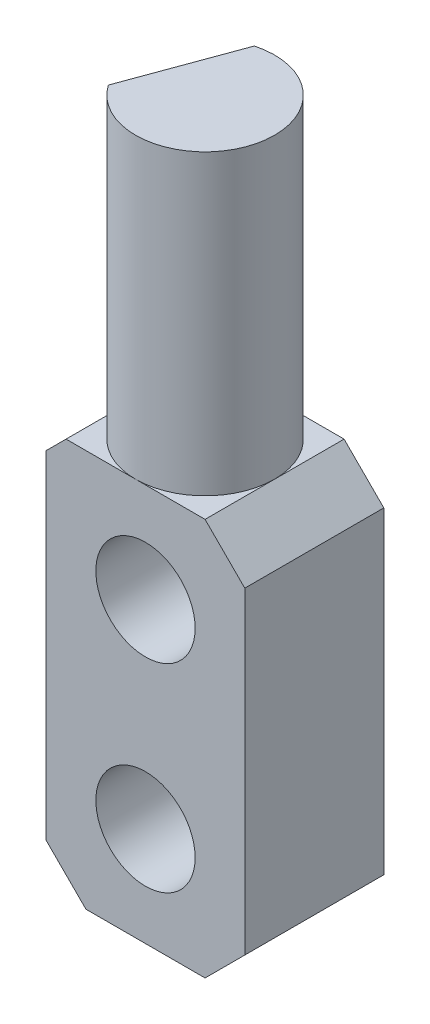
from build123d import *

# Parameters (mm, degrees)
SKETCH1_W               = 10
SKETCH1_H               = 20
BOSS_EXTRUDE1_DEPTH     = 7
SKETCH2_R               = 3.5
BOSS_EXTRUDE2_DEPTH     = 15
SKETCH3_R               = 2.5
CUT_EXTRUDE1_DEPTH      = 38.067505986
CUT_EXTRUDE2_DEPTH      = 37.961317978
CUT_EXTRUDE2_DEPTH_BACK = 37.961317978
CHAMFER1_SIZE           = 2
CHAMFER2_SIZE           = 1


with BuildPart() as part:
    # Sketch1 → Boss-Extrude1 (new body)
    with BuildSketch(Plane.XY):
        with Locations((5, 10)):
            Rectangle(SKETCH1_W, SKETCH1_H)
    extrude(amount=BOSS_EXTRUDE1_DEPTH)

    # Sketch2 → Boss-Extrude2 (add)
    with BuildSketch(Plane(origin=(0, 20, 0), x_dir=(1, 0, 0), z_dir=(0, 1, 0))):
        with Locations(Location((4.5, -3.5, 0), (0, 0, 90))):
            Circle(SKETCH2_R)
    extrude(amount=BOSS_EXTRUDE2_DEPTH)

    # Sketch3 → Cut-Extrude1 (cut, through all)
    with BuildSketch(Plane.XY.offset(7)):
        with Locations((5, 15)):
            Circle(SKETCH3_R)
        with Locations((5, 5)):
            Circle(SKETCH3_R)
    extrude(amount=-CUT_EXTRUDE1_DEPTH, mode=Mode.SUBTRACT)

    # Sketch4 → Cut-Extrude2 (cut, two sides: drawn at the far end of the back side and taken through both)
    with BuildSketch(Plane(origin=(-0.597969362, 0, 1.631380802), x_dir=(0.9389141835786157, 0, 0.34415135605559033), z_dir=(-0.34415135605559033, 0, 0.9389141835786157)).offset(-CUT_EXTRUDE2_DEPTH_BACK)):
        Polygon((1.929643572, 35), (3.419643572, 35), (3.419643572, 34.4), (3.919643572, 34.4), (3.919643572, 33.4), (1.929643572, 31.265986267), align=None)
    extrude(amount=CUT_EXTRUDE2_DEPTH + CUT_EXTRUDE2_DEPTH_BACK, mode=Mode.SUBTRACT)

    # Chamfer1
    chamfer1_edges = [part.edges().sort_by_distance(p)[0] for p in [
        (10, 20, 3.5),
        (10, 0, 3.5),
        (0, 0, 3.5),
    ]]
    chamfer(chamfer1_edges, length=CHAMFER1_SIZE - 0.0001)  # a hair under: the kernel refuses the full size

    # Chamfer2
    chamfer2_edges = [part.edges().sort_by_distance(p)[0] for p in [
        (0, 20, 3.5),
    ]]
    chamfer(chamfer2_edges, length=CHAMFER2_SIZE - 0.0001)  # a hair under: the kernel refuses the full size


solid = part.part
